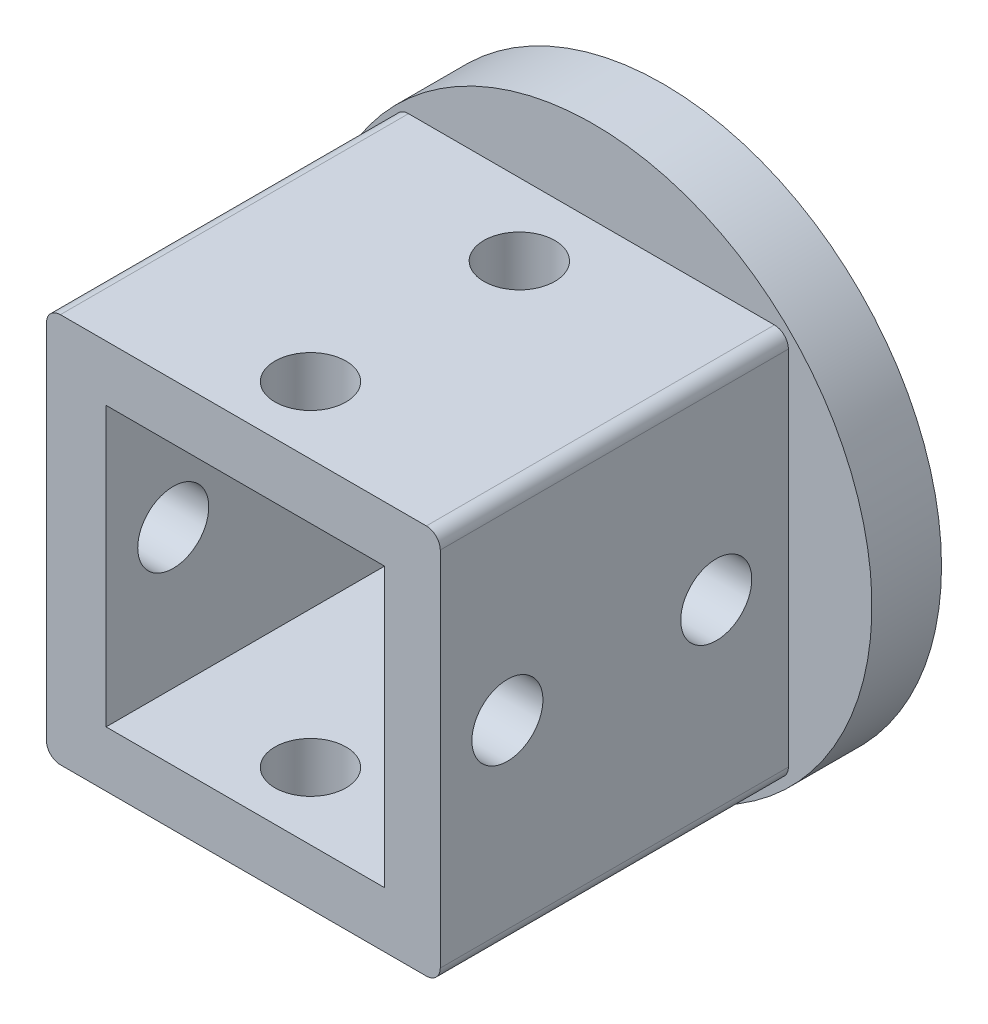
from build123d import *

# Parameters (mm, degrees)
SKETCH_1_R          = 20
EXTRUDE_1_DEPTH     = 5
SKETCH_2_R          = 1.5
CUT_EXTRUDE_1_DEPTH = 5
SKETCH_4_W          = 28.282856857
SKETCH_4_H          = 28
SKETCH_4_W_2        = 20
SKETCH_4_H_2        = 20
EXTRUDE_3_DEPTH     = 25
SKETCH_5_R          = 2.55
CUT_EXTRUDE_2_DEPTH = 50.75253033
SKETCH_6_R          = 2.55
CUT_EXTRUDE_3_DEPTH = 50.558046773
FILLET_2_R          = 1


with BuildPart() as part:
    # 草图1 → 凸台-拉伸1 (new body)
    with BuildSketch(Plane.XY):
        Circle(SKETCH_1_R)
    extrude(amount=EXTRUDE_1_DEPTH)

    # 草图2 → 切除-拉伸1 (cut)
    with BuildSketch(Plane.XY.offset(5)):
        with Locations((-4.95, 4.95)):
            Circle(SKETCH_2_R)
        with Locations((4.95, 4.95)):
            Circle(SKETCH_2_R)
        with Locations((-4.95, -4.95)):
            Circle(SKETCH_2_R)
        with Locations((4.95, -4.95)):
            Circle(SKETCH_2_R)
    extrude(amount=-CUT_EXTRUDE_1_DEPTH, mode=Mode.SUBTRACT)

    # 草图4 → 凸台-拉伸3 (add)
    with BuildSketch(Plane.XY.offset(5)):
        with Locations((-0.141428429, 0)):
            Rectangle(SKETCH_4_W, SKETCH_4_H)
        Rectangle(SKETCH_4_W_2, SKETCH_4_H_2, mode=Mode.SUBTRACT)
    extrude(amount=EXTRUDE_3_DEPTH)

    # 草图5 → 切除-拉伸2 (cut, through all)
    with BuildSketch(Plane.ZY.offset(14.282856857)):
        with Locations((10.178577039, 0)):
            Circle(SKETCH_5_R)
        with Locations((25.178577039, 0)):
            Circle(SKETCH_5_R)
        with Locations((40.178577039, 0)):
            Circle(SKETCH_5_R)
    extrude(amount=-CUT_EXTRUDE_2_DEPTH, mode=Mode.SUBTRACT)

    # 草图6 → 切除-拉伸3 (cut, through all)
    with BuildSketch(Plane(origin=(0, 14, 0), x_dir=(1, 0, 0), z_dir=(0, 1, 0))):
        with Locations((-0.141428429, -10.18)):
            Circle(SKETCH_6_R)
        with Locations((-0.141428429, -25.18)):
            Circle(SKETCH_6_R)
        with Locations((-0.141428429, -40.18)):
            Circle(SKETCH_6_R)
    extrude(amount=-CUT_EXTRUDE_3_DEPTH, mode=Mode.SUBTRACT)

    # 圆角2
    fillet_2_edges = [part.edges().sort_by_distance(p)[0] for p in [
        (-14.282856857, -14, 17.5),
        (14, -14, 17.5),
        (-14.282856857, 14, 17.5),
        (14, 14, 17.5),
    ]]
    fillet(fillet_2_edges, radius=FILLET_2_R)


solid = part.part
